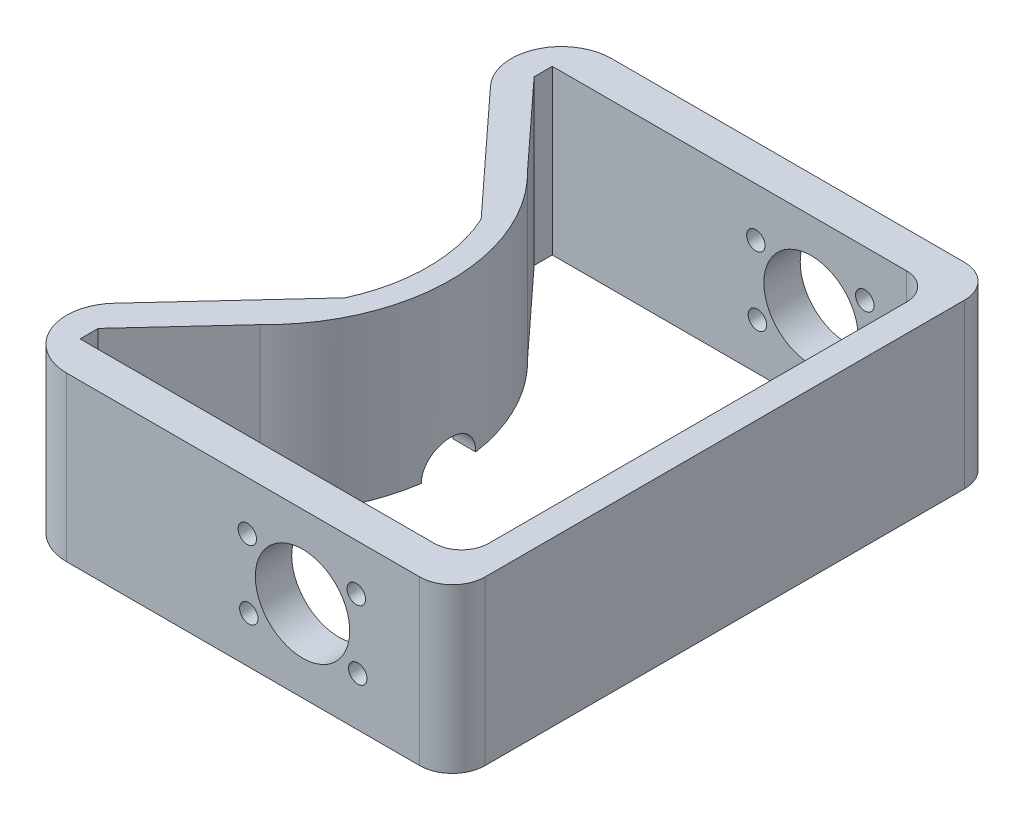
from build123d import *

# Parameters (mm, degrees)
SKETCH1_W               = 95.25
SKETCH1_H               = 8.466666667
BOSS_EXTRUDE1_DEPTH     = 38.1
SKETCH2_W               = 6.35
SKETCH2_H               = 127
BOSS_EXTRUDE2_DEPTH     = 38.1
SKETCH3_W               = 88.9
SKETCH3_H               = 8.466666667
BOSS_EXTRUDE3_DEPTH     = 38.1
SKETCH4_R               = 11
CUT_EXTRUDE1_DEPTH      = 149.412147835
SKETCH5_R               = 2.15265
CUT_EXTRUDE2_DEPTH      = 149.412147835
FILLET1_R               = 7.62
BOSS_EXTRUDE4_DEPTH     = 38.1
CUT_EXTRUDE8_REACH      = 172.773
CUT_EXTRUDE8_END_RADIUS = 38.1
FILLET2_R               = 11.688947
FILLET3_R               = 11.688947
FILLET4_R               = 6.35


with BuildPart() as part:
    # Sketch1 → Boss-Extrude1 (new body)
    with BuildSketch(Plane(origin=(0, 0, 0), x_dir=(1, 0, 0), z_dir=(0, 1, 0))):
        with Locations((19.05, 13.758333334)):
            Rectangle(SKETCH1_W, SKETCH1_H)
    extrude(amount=BOSS_EXTRUDE1_DEPTH)

    # Sketch2 → Boss-Extrude2 (add)
    with BuildSketch(Plane(origin=(0, 38.1, 0), x_dir=(1, 0, 0), z_dir=(0, 1, 0))):
        with Locations((63.5, 73.025)):
            Rectangle(SKETCH2_W, SKETCH2_H)
    extrude(amount=-BOSS_EXTRUDE2_DEPTH)

    # Sketch3 → Boss-Extrude3 (add)
    with BuildSketch(Plane(origin=(0, 38.1, 0), x_dir=(1, 0, 0), z_dir=(0, 1, 0))):
        with Locations((15.875, 132.291666667)):
            Rectangle(SKETCH3_W, SKETCH3_H)
    extrude(amount=-BOSS_EXTRUDE3_DEPTH)

    # Sketch4 → Cut-Extrude1 (cut, through all)
    with BuildSketch(Plane(origin=(0, 0, -136.525), x_dir=(-1, 0, 0), z_dir=(0, 0, -1))):
        with Locations((-31.75, 19.05)):
            Circle(SKETCH4_R)
    extrude(amount=-CUT_EXTRUDE1_DEPTH, mode=Mode.SUBTRACT)

    # Sketch5 → Cut-Extrude2 (cut, through all)
    with BuildSketch(Plane(origin=(0, 0, -136.525), x_dir=(-1, 0, 0), z_dir=(0, 0, -1))):
        with Locations((-18.877667779, 26.704865736)):
            Circle(SKETCH5_R)
        with Locations((-19.228536904, 10.833743663)):
            Circle(SKETCH5_R)
        with Locations((-44.622332221, 11.395134264)):
            Circle(SKETCH5_R)
        with Locations((-44.271463096, 27.266256337)):
            Circle(SKETCH5_R)
    extrude(amount=-CUT_EXTRUDE2_DEPTH, mode=Mode.SUBTRACT)

    # Fillet1
    fillet1_edges = [part.edges().sort_by_distance(p)[0] for p in [
        (66.675, 19.05, -136.525),
        (66.675, 19.05, -9.525),
    ]]
    fillet(fillet1_edges, radius=FILLET1_R)

    # Sketch10 → Boss-Extrude4 (add)
    with BuildSketch(Plane(origin=(0, 38.1, 0), x_dir=(1, 0, 0), z_dir=(0, 1, 0))):
        with BuildLine():
            Line((-28.575, 17.991666667), (-28.575, 9.525))
            Line((-28.575, 9.525), (-34.925, 9.525))
            Line((-34.925, 9.525), (-34.925, 25.781))
            Line((-34.925, 25.781), (-5.996027965, 57.15))
            ThreePointArc((-5.996027965, 57.15), (-2.531188929, 73.025), (-5.996027965, 88.9))
            Line((-5.996027965, 88.9), (-34.925, 120.269))
            Line((-34.925, 120.269), (-34.925, 136.525))
            Line((-34.925, 136.525), (-28.575, 136.525))
            Line((-28.575, 136.525), (-28.575, 123.825))
            Line((-28.575, 123.825), (-10.494392478, 104.219375))
            ThreePointArc((-10.494392478, 104.219375), (2.742945437, 73.025), (-10.494392478, 41.830625))
            Line((-10.494392478, 41.830625), (-28.575, 22.225))
            Line((-28.575, 22.225), (-28.575, 17.991666667))
        make_face()
    extrude(amount=-BOSS_EXTRUDE4_DEPTH)

    # Cut-Extrude8: up to this cylinder (the profile starts outside it)
    cut_extrude8_end = Plane(origin=(-40.631188929, 2.695024, -73.025), z_dir=(0, 1, 0)) * Cylinder(CUT_EXTRUDE8_END_RADIUS, 422.746, mode=Mode.PRIVATE)
    # Sketch12 → Cut-Extrude8 (cut, up to the surface)
    with BuildSketch(Plane.ZY.offset(-60.325), mode=Mode.PRIVATE) as cut_extrude8_sk1:
        with BuildLine():
            Line((-79.375, 0), (-66.675, 0))
            ThreePointArc((-66.675, 0), (-73.025, 6.35), (-79.375, 0))
        make_face()
    cut_extrude8_tool1 = extrude(cut_extrude8_sk1.sketch, amount=CUT_EXTRUDE8_REACH, mode=Mode.PRIVATE) - cut_extrude8_end
    add(cut_extrude8_tool1.solids().sort_by_distance((60.325, 2.695024, -73.025))[0], mode=Mode.SUBTRACT)

    # Fillet2
    fillet2_edges = [part.edges().sort_by_distance(p)[0] for p in [
        (-34.925, 19.05, -136.525),
        (-34.925, 19.05, -120.269),
    ]]
    fillet(fillet2_edges, radius=FILLET2_R - 0.0001)  # a hair under: the kernel refuses the full size

    # Fillet3
    fillet3_edges = [part.edges().sort_by_distance(p)[0] for p in [
        (-34.925, 19.05, -25.781),
        (-34.925, 19.05, -9.525),
    ]]
    fillet(fillet3_edges, radius=FILLET3_R - 0.0001)  # a hair under: the kernel refuses the full size

    # Fillet4
    fillet4_edges = [part.edges().sort_by_distance(p)[0] for p in [
        (60.325, 19.05, -17.991666667),
        (60.325, 19.05, -128.058333333),
    ]]
    fillet(fillet4_edges, radius=FILLET4_R)


solid = part.part
